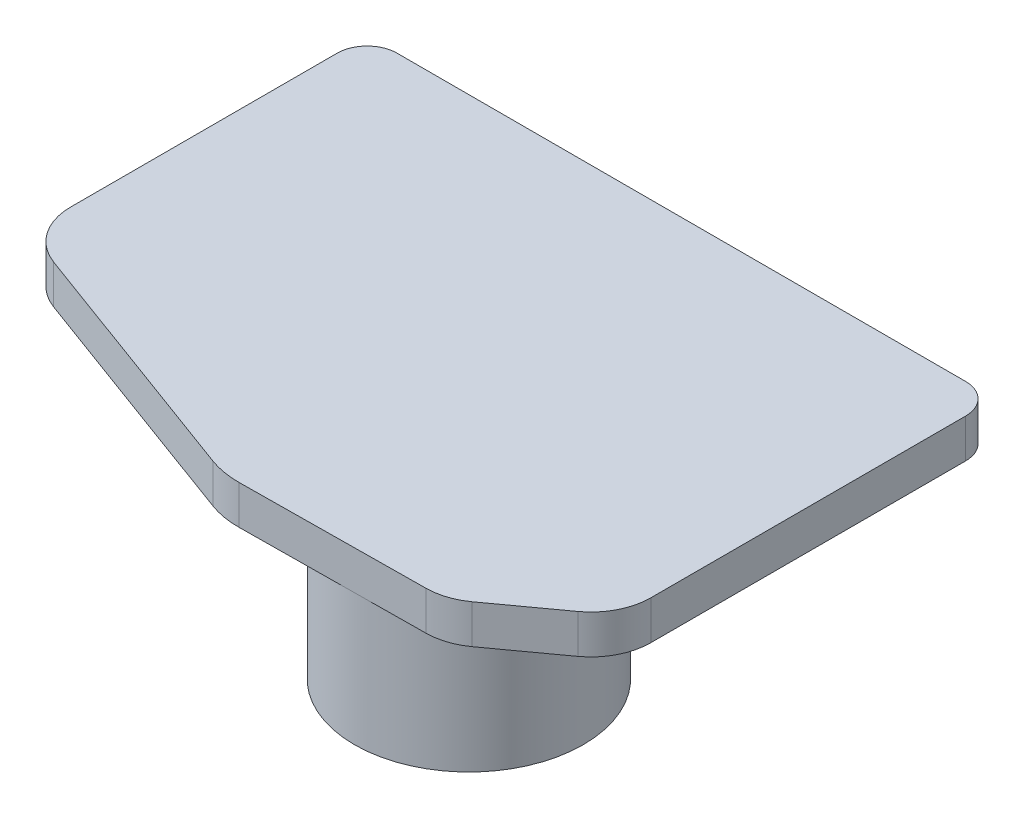
from build123d import *

# Parameters (mm, degrees)
BOSS_EXTRUDE2_DEPTH = 13
SKETCH3_R           = 38.233046149
BOSS_EXTRUDE3_DEPTH = 44


with BuildPart() as part:
    # Sketch1 → Boss-Extrude2 (new body)
    with BuildSketch(Plane(origin=(0, 0, 0), x_dir=(1, 0, 0), z_dir=(0, 1, 0))):
        with BuildLine():
            Line((96.745489951, -56.35369823), (76.301036014, -71.187756664))
            ThreePointArc((76.301036014, -71.187756664), (70.824268373, -73.992185777), (64.754169199, -74.999013697))
            Line((64.754169199, -74.999013697), (2.891728169, -75.613409598))
            ThreePointArc((2.891728169, -75.613409598), (-2.51970919, -75.17587839), (-7.763678838, -73.770221895))
            Line((-7.763678838, -73.770221895), (-91.904981536, -42.817250494))
            ThreePointArc((-91.904981536, -42.817250494), (-101.402738044, -35.490375341), (-105, -24.047028599))
            Line((-105, -24.047028599), (-105, 65))
            ThreePointArc((-105, 65), (-102.071067812, 72.071067812), (-95, 75))
            Line((-95, 75), (95, 75))
            ThreePointArc((95, 75), (102.071067812, 72.071067812), (105, 65))
            Line((105, 65), (105, -40.165941566))
            ThreePointArc((105, -40.165941566), (102.817264086, -49.25137499), (96.745489951, -56.35369823))
        make_face()
    extrude(amount=BOSS_EXTRUDE2_DEPTH)

    # Sketch3 → Boss-Extrude3 (add)
    with BuildSketch(Plane(origin=(0, 0, 0), x_dir=(1, 0, 0), z_dir=(0, 1, 0))):
        with Locations((41, -37)):
            Circle(SKETCH3_R)
    extrude(amount=-BOSS_EXTRUDE3_DEPTH)


solid = part.part
